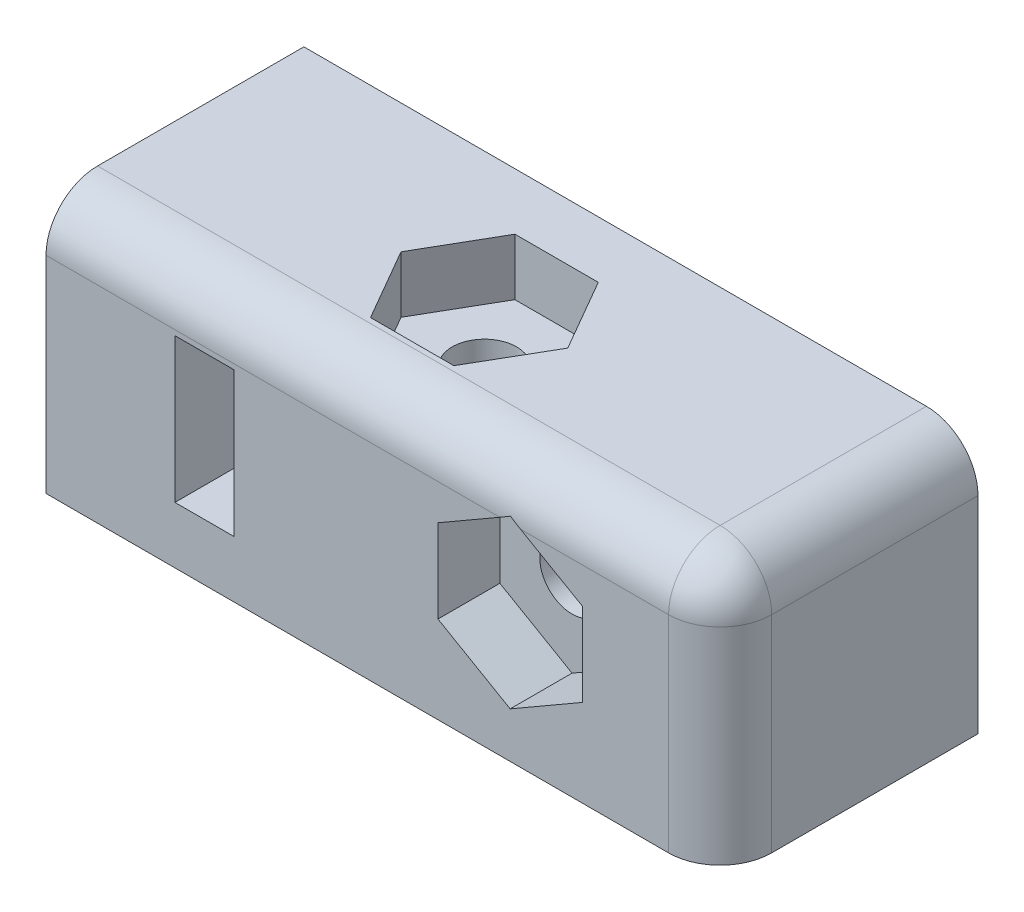
from build123d import *

# Parameters (mm, degrees)
SKETCH1_W           = 74.5
SKETCH1_H           = 10
BOSS_EXTRUDE1_DEPTH = 10
SKETCH2_R           = 1.25
CUT_EXTRUDE1_DEPTH  = 10
SKETCH3_R           = 1.25
CUT_EXTRUDE2_DEPTH  = 10
SKETCH4_R           = 1.25
CUT_EXTRUDE3_DEPTH  = 5
CUT_EXTRUDE4_START  = -5
SKETCH5_R           = 1.25
CUT_EXTRUDE4_DEPTH  = 5
CUT_EXTRUDE5_DEPTH  = 2.2
CUT_EXTRUDE6_DEPTH  = 2.2
CUT_EXTRUDE8_DEPTH  = 2.2
SKETCH11_W          = 2.3
SKETCH11_H          = 5.6
CUT_EXTRUDE9_DEPTH  = 7.3
SKETCH12_W          = 92.79599186
SKETCH12_H          = 35.188487641
CUT_EXTRUDE10_DEPTH = 14
CUT_EXTRUDE11_DEPTH = 2.4
FILLET1_R           = 2
FILLET2_R           = 2


with BuildPart() as part:
    # Sketch1 → Boss-Extrude1 (new body)
    with BuildSketch(Plane(origin=(0, 0, 0), x_dir=(1, 0, 0), z_dir=(0, 1, 0))):
        with Locations((37.25, 5)):
            Rectangle(SKETCH1_W, SKETCH1_H)
    extrude(amount=BOSS_EXTRUDE1_DEPTH)

    # Sketch2 → Cut-Extrude1 (cut)
    with BuildSketch(Plane(origin=(0, 10, 0), x_dir=(1, 0, 0), z_dir=(0, 1, 0))):
        with Locations(Location((12, 5, 0), (0, 0, 270))):
            Circle(SKETCH2_R)
        with Locations(Location((62.5, 5, 0), (0, 0, 270))):
            Circle(SKETCH2_R)
    extrude(amount=-CUT_EXTRUDE1_DEPTH, mode=Mode.SUBTRACT)

    # Sketch3 → Cut-Extrude2 (cut)
    with BuildSketch(Plane(origin=(0, 0, -10), x_dir=(-1, 0, 0), z_dir=(0, 0, -1))):
        with Locations((-56.5, 5)):
            Circle(SKETCH3_R)
        with Locations((-18, 5)):
            Circle(SKETCH3_R)
    extrude(amount=-CUT_EXTRUDE2_DEPTH, mode=Mode.SUBTRACT)

    # Sketch4 → Cut-Extrude3 (cut)
    with BuildSketch(Plane(origin=(74.5, 0, 0), x_dir=(0, 0, -1), z_dir=(1, 0, 0))):
        with Locations((5, 5)):
            Circle(SKETCH4_R)
    extrude(amount=-CUT_EXTRUDE3_DEPTH, mode=Mode.SUBTRACT)

    # Sketch5 → Cut-Extrude4 (cut)
    with BuildSketch(Plane.ZY.offset(CUT_EXTRUDE4_START)):
        with Locations(Location((-5, 5, 0), (0, 0, 180))):
            Circle(SKETCH5_R)
    extrude(amount=CUT_EXTRUDE4_DEPTH, mode=Mode.SUBTRACT)

    # Sketch6 → Cut-Extrude5 (cut)
    with BuildSketch(Plane(origin=(0, 10, 0), x_dir=(1, 0, 0), z_dir=(0, 1, 0))):
        Polygon((13.616580754, 2.2), (15.233161507, 5), (13.616580754, 7.8), (10.383419246, 7.8), (8.766838493, 5), (10.383419246, 2.2), align=None)
    extrude(amount=-CUT_EXTRUDE5_DEPTH, mode=Mode.SUBTRACT)

    # Sketch7 → Cut-Extrude6 (cut)
    with BuildSketch(Plane(origin=(0, 10, 0), x_dir=(1, 0, 0), z_dir=(0, 1, 0))):
        Polygon((60.883419246, 7.8), (59.266838493, 5), (60.883419246, 2.2), (64.116580754, 2.2), (65.733161507, 5), (64.116580754, 7.8), align=None)
    extrude(amount=-CUT_EXTRUDE6_DEPTH, mode=Mode.SUBTRACT)

    # Sketch9 → Cut-Extrude8 (cut)
    with BuildSketch(Plane.XY):
        Polygon((58.116580754, 7.8), (54.883419246, 7.8), (53.266838493, 5), (54.883419246, 2.2), (58.116580754, 2.2), (59.733161507, 5), align=None)
    extrude(amount=-CUT_EXTRUDE8_DEPTH, mode=Mode.SUBTRACT)

    # Sketch11 → Cut-Extrude9 (cut)
    with BuildSketch(Plane.XY):
        with Locations((6.15, 5)):
            Rectangle(SKETCH11_W, SKETCH11_H)
        with Locations((68.35, 5)):
            Rectangle(SKETCH11_W, SKETCH11_H)
    extrude(amount=-CUT_EXTRUDE9_DEPTH, mode=Mode.SUBTRACT)

    # Sketch12 → Cut-Extrude10 (cut)
    with BuildSketch(Plane.XY):
        with Locations((72.539564665, 12.110455679)):
            Rectangle(SKETCH12_W, SKETCH12_H)
    extrude(amount=-CUT_EXTRUDE10_DEPTH, mode=Mode.SUBTRACT)

    # Sketch13 → Cut-Extrude11 (cut)
    with BuildSketch(Plane.XY):
        Polygon((20.8, 6.616580754), (18, 8.233161507), (15.2, 6.616580754), (15.2, 3.383419246), (18, 1.766838493), (20.8, 3.383419246), align=None)
    extrude(amount=-CUT_EXTRUDE11_DEPTH, mode=Mode.SUBTRACT)

    # Fillet1
    fillet1_edges = [part.edges().sort_by_distance(p)[0] for p in [
        (26.141568735, 5, 0),
    ]]
    fillet(fillet1_edges, radius=FILLET1_R)

    # Fillet2
    # the kernel refuses this fillet: 2 mm, written as the material it takes off along each edge
    with BuildSketch(Plane(origin=(26.141568735, 10, -15), x_dir=(-1, 0, 0), z_dir=(0, 0, 1))) as fillet2_piece_1:
        with BuildLine():
            CenterArc((FILLET2_R, FILLET2_R), FILLET2_R, 180, 90)
            Line((0, FILLET2_R), (0, 0))
            Line((0, 0), (FILLET2_R, 0))
        make_face()
    extrude(amount=13, mode=Mode.SUBTRACT)
    with BuildSketch(Plane(origin=(24.141568735, 10, -2), x_dir=(0, 0, 1), z_dir=(-1, 0, 0))) as fillet2_piece_2:
        with BuildLine():
            CenterArc((2 - FILLET2_R, -FILLET2_R), FILLET2_R, 0, 90)
            Line((2 - FILLET2_R, 0), (2, 0))
            Line((2, 0), (2, -FILLET2_R))
        make_face()
    revolve(axis=Axis((24.141568735, 10, -2), (0, 1, 0)), revolution_arc=90, mode=Mode.SUBTRACT)
    with BuildSketch(Plane(origin=(-5, 10, 0), x_dir=(0, -1, 0), z_dir=(1, 0, 0))) as fillet2_piece_3:
        with BuildLine():
            CenterArc((FILLET2_R, FILLET2_R), FILLET2_R, 180, 90)
            Line((0, FILLET2_R), (0, 0))
            Line((0, 0), (FILLET2_R, 0))
        make_face()
    extrude(amount=29.141568735, mode=Mode.SUBTRACT)


solid = part.part
